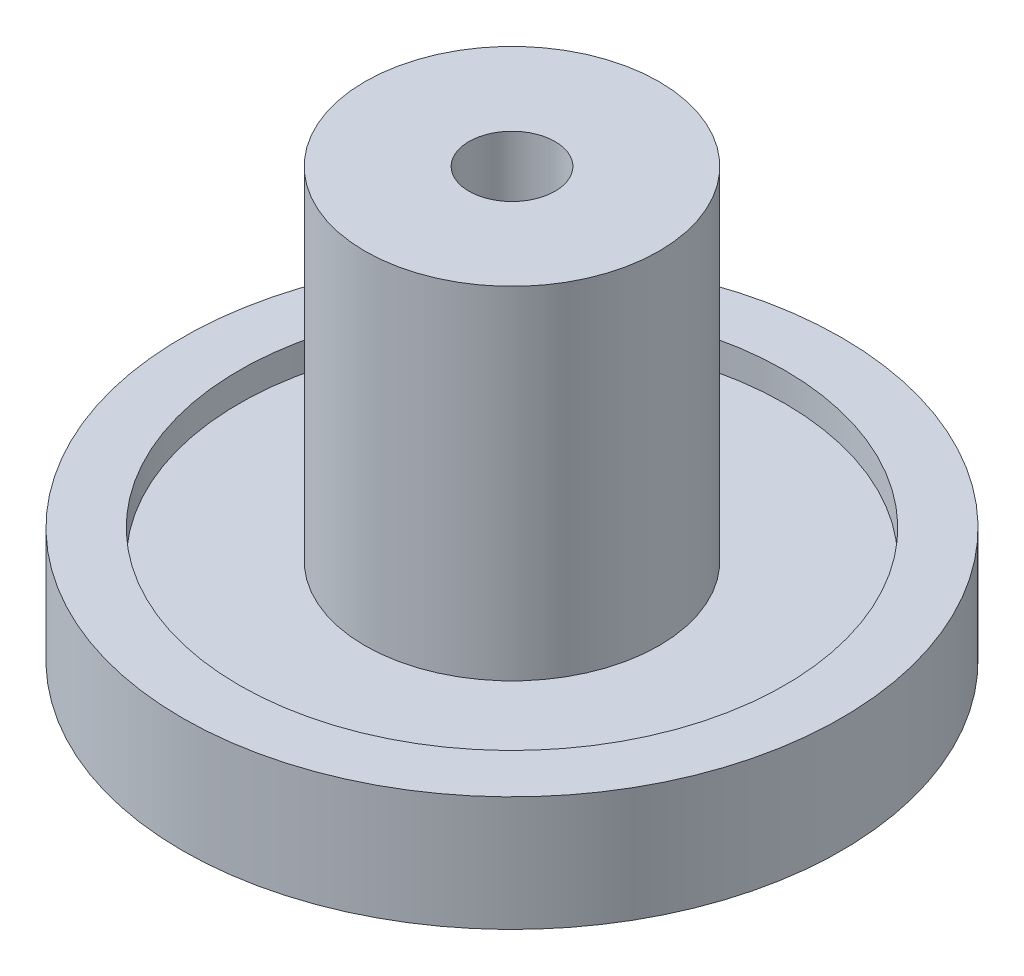
from build123d import *


with BuildPart() as part:
    # Sketch1 → 20 and 58 (revolve)
    with BuildSketch(Plane.XY):
        Polygon((1.5, 14.9), (1.5, 0), (3.5, 0), (3.5, 1.2), (9.5, 1.2), (9.5, 0), (11.477625, 0), (11.477625, 4), (9.5, 4), (9.5, 3), (5.1181, 3), (5.1181, 14.9), align=None)
    revolve(axis=Axis((0, 0, 0), (0, 1, 0)))


solid = part.part
